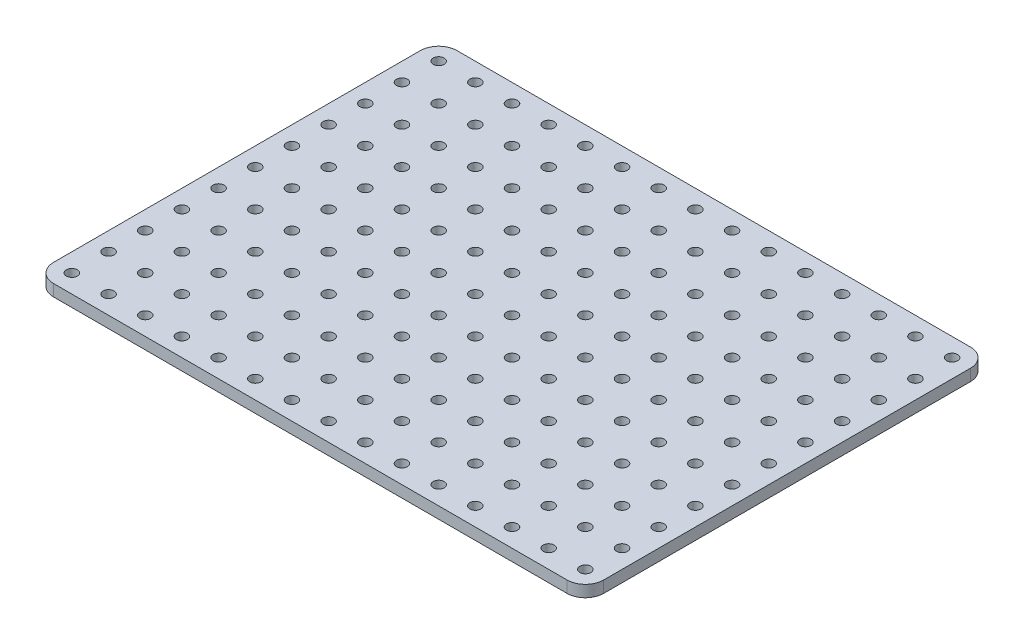
from build123d import *

# Parameters (mm, degrees)
SKETCH1_W            = 10
SKETCH1_H            = 10
SKETCH1_R            = 1.5
BOSS_EXTRUDE1_DEPTH  = 1.5875
LPATTERN1_COUNT      = 15
LPATTERN1_PITCH      = 10
LPATTERN1_COUNT_DIR2 = 11
LPATTERN1_PITCH_DIR2 = 10
FILLET1_R            = 5


with BuildPart() as part:
    # Sketch1 → Boss-Extrude1 (new, symmetric)
    with BuildSketch(Plane(origin=(0, 0, 0), x_dir=(1, 0, 0), z_dir=(0, 1, 0))):
        Rectangle(SKETCH1_W, SKETCH1_H)
        Circle(SKETCH1_R, mode=Mode.SUBTRACT)
    boss_extrude1 = extrude(amount=BOSS_EXTRUDE1_DEPTH, both=True)

    # LPattern1: Boss-Extrude1 15 × 11
    with Locations(*[(i * LPATTERN1_PITCH, 0, j * LPATTERN1_PITCH_DIR2) for i in range(LPATTERN1_COUNT) for j in range(LPATTERN1_COUNT_DIR2) if (i, j) != (0, 0)]):
        add(boss_extrude1)

    # Fillet1
    fillet1_edges = [part.edges().sort_by_distance(p)[0] for p in [
        (-5, 0, -5),
        (-5, 0, 105),
        (145, 0, 105),
        (145, 0, -5),
    ]]
    fillet(fillet1_edges, radius=FILLET1_R)


solid = part.part
